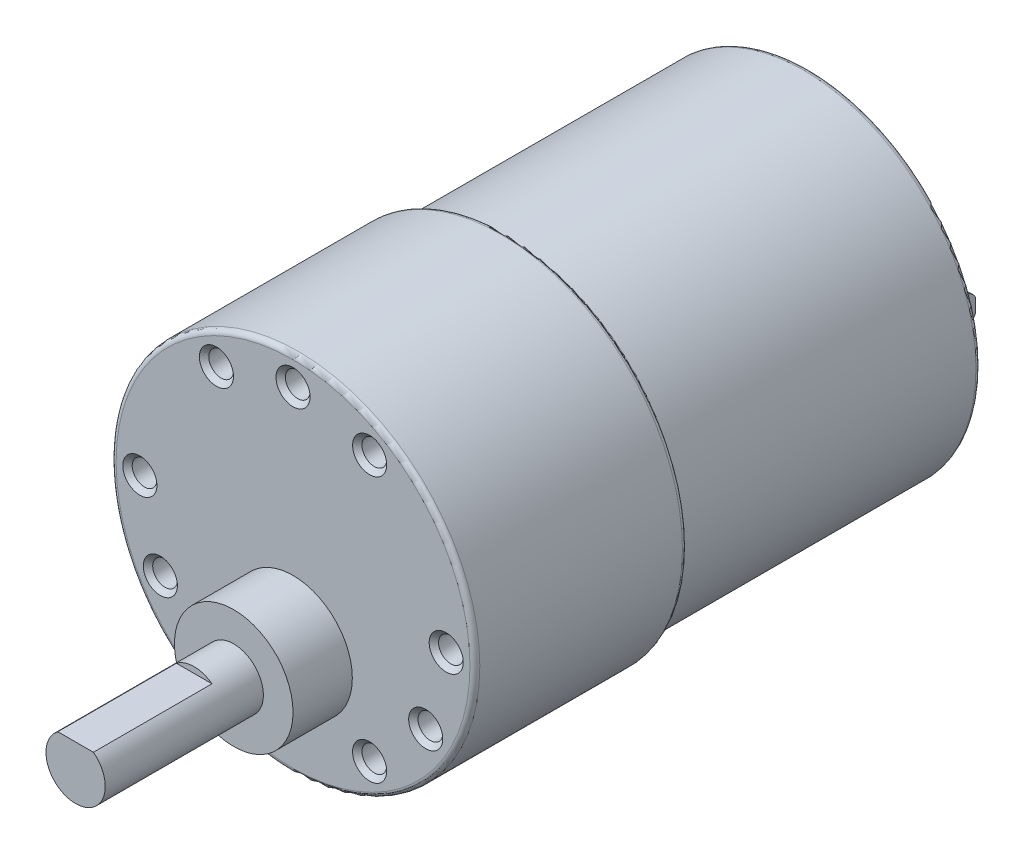
from build123d import *

# Parameters (mm, degrees)
SKETCH1_R                  = 18.4
GEAR_BOX_DEPTH             = 21.5
SKETCH2_R                  = 17.4
MOTOR_COILS_DEPTH          = 30.7
SKETCH3_R                  = 1.55
BOSS_EXTRUDE3_DEPTH        = 0.5
SKETCH4_W                  = 0.5
SKETCH4_H                  = 2.9
BOSS_EXTRUDE4_DEPTH        = 4.5
CUT_EXTRUDE1_DEPTH         = 51.287761844
SKETCH7_R                  = 3.9
BOSS_EXTRUDE5_DEPTH        = 1.6
SKETCH8_R                  = 6
BOSS_EXTRUDE6_DEPTH        = 6
SKETCH9_R                  = 3
BOSS_EXTRUDE7_DEPTH        = 16
CUT_EXTRUDE2_START         = -12
CUT_EXTRUDE2_DEPTH         = 12
M3_TAPPED_HOLE1_AT_2_COUNT = 2
M3_TAPPED_HOLE1_AT_2_PITCH = 8.023390398
M3_TAPPED_HOLE1_AT_3_COUNT = 2
M3_TAPPED_HOLE1_AT_3_PITCH = 8.023390398
CIRPATTERN1_COUNT          = 3
FILLET1_R                  = 0.5


with BuildPart() as part:
    # Sketch1 → gear box (new body)
    with BuildSketch(Plane.XY):
        Circle(SKETCH1_R)
    extrude(amount=GEAR_BOX_DEPTH)

    # Sketch2 → motor coils (add)
    with BuildSketch(Plane(origin=(0, 0, 0), x_dir=(-1, 0, 0), z_dir=(0, 0, -1))):
        Circle(SKETCH2_R)
    extrude(amount=MOTOR_COILS_DEPTH)

    # Sketch3 → Boss-Extrude3 (add)
    with BuildSketch(Plane(origin=(0, 0, -30.7), x_dir=(-1, 0, 0), z_dir=(0, 0, -1))):
        with Locations((-11.612336184, 0)):
            Circle(SKETCH3_R)
        with Locations(Location((11.612336184, 0, 0), (0, 0, 180))):
            Circle(SKETCH3_R)
    extrude(amount=BOSS_EXTRUDE3_DEPTH)

    # Sketch4 → Boss-Extrude4 (add)
    with BuildSketch(Plane(origin=(0, 0, -31.2), x_dir=(-1, 0, 0), z_dir=(0, 0, -1))):
        with Locations((-11.612336184, 0)):
            Rectangle(SKETCH4_W, SKETCH4_H)
    boss_extrude4 = extrude(amount=BOSS_EXTRUDE4_DEPTH)

    # Mirror1: Boss-Extrude4 across plane
    add(boss_extrude4.mirror(Plane(origin=(0, 0, 0), x_dir=(0, 0, 1), z_dir=(1, 0, 0))))

    # Sketch6 → Cut-Extrude1 (cut, through all)
    with BuildSketch(Plane(origin=(11.862336184, 0, 0), x_dir=(0, 0, -1), z_dir=(1, 0, 0))):
        with BuildLine():
            Line((32.167014429, 0.591981898), (34.676080677, 0.591981898))
            ThreePointArc((34.676080677, 0.591981898), (35.268062575, 0), (34.676080677, -0.591981898))
            Line((34.676080677, -0.591981898), (32.167014429, -0.591981898))
            ThreePointArc((32.167014429, -0.591981898), (31.57503253, 0), (32.167014429, 0.591981898))
        make_face()
        with BuildLine():
            Line((34.790187422, 1.45), (35.854606249, 1.94847428))
            Line((35.854606249, 1.94847428), (37.860033025, 0.482970098))
            Line((37.860033025, 0.482970098), (37.50522675, -1.306487641))
            Line((37.50522675, -1.306487641), (35.175846418, -1.877262954))
            Line((35.175846418, -1.877262954), (34.790187422, -1.45))
            add(Edge.make_bspline(
                [(34.790187422, -1.45), (35.400354149, -1.261268387), (35.7, -0.698939135)],
                knots=[0, 0, 0, 1, 1, 1], degree=2))
            Line((35.7, -0.698939135), (35.7, 0.698939135))
            add(Edge.make_bspline(
                [(34.790187422, 1.45), (35.400354149, 1.261268387), (35.7, 0.698939135)],
                knots=[0, 0, 0, 1, 1, 1], degree=2))
        make_face()
    extrude(amount=-CUT_EXTRUDE1_DEPTH, mode=Mode.SUBTRACT)

    # Sketch7 → Boss-Extrude5 (add)
    with BuildSketch(Plane(origin=(0, 0, -30.7), x_dir=(-1, 0, 0), z_dir=(0, 0, -1))):
        Circle(SKETCH7_R)
    extrude(amount=BOSS_EXTRUDE5_DEPTH)

    # Sketch8 → Boss-Extrude6 (add)
    with BuildSketch(Plane.XY.offset(21.5)):
        with Locations((0, -7)):
            Circle(SKETCH8_R)
    extrude(amount=BOSS_EXTRUDE6_DEPTH)

    # Sketch9 → Boss-Extrude7 (add)
    with BuildSketch(Plane.XY.offset(27.5)):
        with Locations((0, -7)):
            Circle(SKETCH9_R)
    extrude(amount=BOSS_EXTRUDE7_DEPTH)

    # Sketch10 → Cut-Extrude2 (cut)
    with BuildSketch(Plane.XY.offset(43.5).offset(CUT_EXTRUDE2_START)):
        with BuildLine():
            Line((-1.8, -4.6), (1.8, -4.6))
            ThreePointArc((1.8, -4.6), (0, -4), (-1.8, -4.6))
        make_face()
    extrude(amount=CUT_EXTRUDE2_DEPTH, mode=Mode.SUBTRACT)

    # Sketch11 → M3 Tapped Hole1 (revolve, cut)
    with BuildSketch(Plane(origin=(0, 15.5, 21.5), x_dir=(0, -1, 0), z_dir=(1, 0, 0))):
        Polygon((0, 0), (0, 5), (1.25, 4.248924226), (1.25, 0.475), (1.725, 0), align=None)
    m3_tapped_hole1 = revolve(axis=Axis((0, 15.5, 27.85), (0, 0, -1)), mode=Mode.SUBTRACT)

    # M3 Tapped Hole1 at 2: M3 Tapped Hole1 ×2
    with Locations(*[Vector(-0.9659258262890683, -0.2588190451025208, 0) * (i * M3_TAPPED_HOLE1_AT_2_PITCH) for i in range(1, M3_TAPPED_HOLE1_AT_2_COUNT)]):
        add(m3_tapped_hole1, mode=Mode.SUBTRACT)

    # M3 Tapped Hole1 at 3: M3 Tapped Hole1 ×2
    with Locations(*[Vector(0.9659258262890683, -0.2588190451025208, 0) * (i * M3_TAPPED_HOLE1_AT_3_PITCH) for i in range(1, M3_TAPPED_HOLE1_AT_3_COUNT)]):
        add(m3_tapped_hole1, mode=Mode.SUBTRACT)

    # CirPattern1: M3 Tapped Hole1 ×3 about axis
    cirpattern1_axis = Axis((0, 0, 0), (0, 0, 1))
    for i in range(1, CIRPATTERN1_COUNT):
        add(m3_tapped_hole1.rotate(cirpattern1_axis, i * 360 / CIRPATTERN1_COUNT), mode=Mode.SUBTRACT)

    # CirPattern1 copy 1 sketch → CirPattern1 copy 1 (revolve, cut)
    with BuildSketch(Plane(origin=(-7.75, -13.423393759, 21.5), x_dir=(0.8660254037844387, 0.4999999999999998, 0), z_dir=(-0.4999999999999998, 0.8660254037844387, 0))):
        Polygon((0, 0), (0, 5), (1.25, 4.248924226), (1.25, 0.475), (1.725, 0), align=None)
    revolve(axis=Axis((-7.75, -13.423393759, 27.85), (0, 0, -1)), mode=Mode.SUBTRACT)

    # CirPattern1 copy 2 sketch → CirPattern1 copy 2 (revolve, cut)
    with BuildSketch(Plane(origin=(15.5, 0, 21.5), x_dir=(-0.8660254037844384, 0.5000000000000004, 0), z_dir=(-0.5000000000000004, -0.8660254037844384, 0))):
        Polygon((0, 0), (0, 5), (1.25, 4.248924226), (1.25, 0.475), (1.725, 0), align=None)
    revolve(axis=Axis((15.5, 0, 27.85), (0, 0, -1)), mode=Mode.SUBTRACT)

    # CirPattern1 copy 3 sketch → CirPattern1 copy 3 (revolve, cut)
    with BuildSketch(Plane(origin=(-15.5, 0, 21.5), x_dir=(0.8660254037844387, 0.4999999999999998, 0), z_dir=(-0.4999999999999998, 0.8660254037844387, 0))):
        Polygon((0, 0), (0, 5), (1.25, 4.248924226), (1.25, 0.475), (1.725, 0), align=None)
    revolve(axis=Axis((-15.5, 0, 27.85), (0, 0, -1)), mode=Mode.SUBTRACT)

    # CirPattern1 copy 4 sketch → CirPattern1 copy 4 (revolve, cut)
    with BuildSketch(Plane(origin=(7.75, -13.423393759, 21.5), x_dir=(-0.8660254037844384, 0.5000000000000004, 0), z_dir=(-0.5000000000000004, -0.8660254037844384, 0))):
        Polygon((0, 0), (0, 5), (1.25, 4.248924226), (1.25, 0.475), (1.725, 0), align=None)
    revolve(axis=Axis((7.75, -13.423393759, 27.85), (0, 0, -1)), mode=Mode.SUBTRACT)

    # Fillet1
    fillet1_edges = [part.edges().sort_by_distance(p)[0] for p in [
        (-18.4, 0, 0),
        (-18.4, 0, 21.5),
        (17.4, 0, 0),
        (17.4, 0, -30.7),
    ]]
    fillet(fillet1_edges, radius=FILLET1_R - 0.0001)  # a hair under: the kernel refuses the full size


solid = part.part
